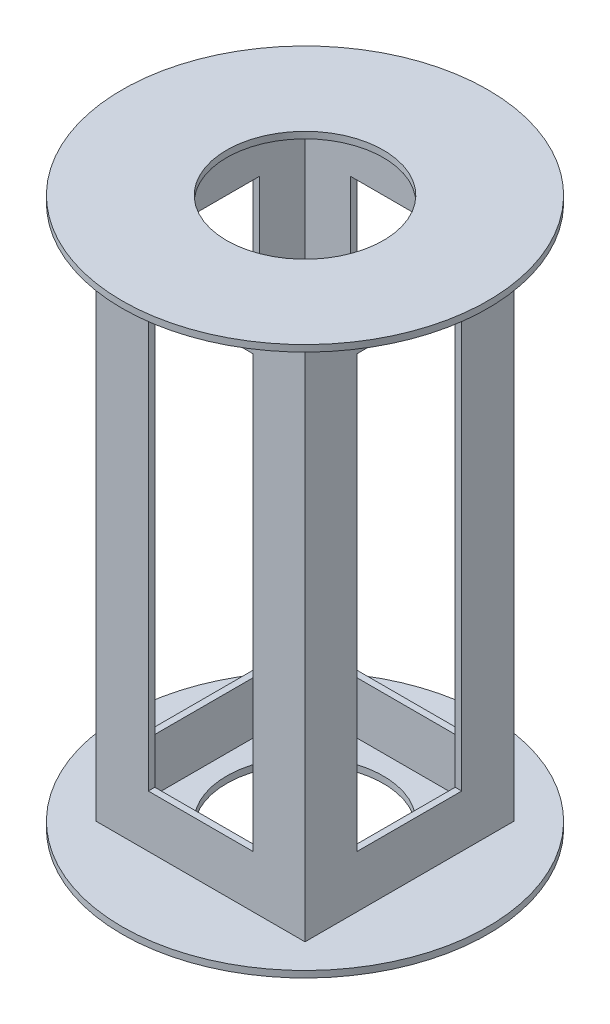
from build123d import *

# Parameters (mm, degrees)
SKETCH2_R               = 88.9
SKETCH2_R_2             = 38.1
BOSS_EXTRUDE1_DEPTH     = 3.175
SKETCH2_4_W             = 101.6
SKETCH2_4_H             = 101.6
SKETCH2_4_W_2           = 95.25
SKETCH2_4_H_2           = 95.25
BOSS_EXTRUDE2_DEPTH     = 266.7
BOSS_EXTRUDE3_START     = -3.175
SKETCH3_R               = 88.9
SKETCH3_R_2             = 38.1
BOSS_EXTRUDE3_DEPTH     = 3.175
CUT_EXTRUDE1_DEPTH      = 295.847943863
CUT_EXTRUDE1_DEPTH_BACK = 295.847943863
SKETCH4_W               = 50.8
SKETCH4_H               = 209.55
CUT_EXTRUDE2_DEPTH      = 295.847943863
CUT_EXTRUDE2_DEPTH_BACK = 295.847943863
SKETCH5_W               = 50.8
SKETCH5_H               = 209.55


with BuildPart() as part:
    # Sketch2 → Boss-Extrude1 (new body)
    with BuildSketch(Plane(origin=(0, 0, 0), x_dir=(1, 0, 0), z_dir=(0, 1, 0))):
        Circle(SKETCH2_R)
        Circle(SKETCH2_R_2, mode=Mode.SUBTRACT)
    extrude(amount=BOSS_EXTRUDE1_DEPTH)

    # Sketch2<4> → Boss-Extrude2 (add)
    with BuildSketch(Plane(origin=(0, 0, 0), x_dir=(1, 0, 0), z_dir=(0, 1, 0))):
        Rectangle(SKETCH2_4_W, SKETCH2_4_H)
        Rectangle(SKETCH2_4_W_2, SKETCH2_4_H_2, mode=Mode.SUBTRACT)
    extrude(amount=BOSS_EXTRUDE2_DEPTH)

    # Sketch3 → Boss-Extrude3 (add)
    with BuildSketch(Plane(origin=(0, 266.7, 0), x_dir=(1, 0, 0), z_dir=(0, 1, 0)).offset(BOSS_EXTRUDE3_START)):
        Circle(SKETCH3_R)
        Circle(SKETCH3_R_2, mode=Mode.SUBTRACT)
    extrude(amount=BOSS_EXTRUDE3_DEPTH)

    # Sketch4 → Cut-Extrude1 (cut, two sides: drawn at the far end of the back side and taken through both)
    with BuildSketch(Plane.XY.offset(-CUT_EXTRUDE1_DEPTH_BACK)):
        with Locations((0, 133.35)):
            Rectangle(SKETCH4_W, SKETCH4_H)
    extrude(amount=CUT_EXTRUDE1_DEPTH + CUT_EXTRUDE1_DEPTH_BACK, mode=Mode.SUBTRACT)

    # Sketch5 → Cut-Extrude2 (cut, two sides: drawn at the far end of the back side and taken through both)
    with BuildSketch(Plane(origin=(0, 0, 0), x_dir=(0, 0, -1), z_dir=(1, 0, 0)).offset(-CUT_EXTRUDE2_DEPTH_BACK)):
        with Locations((0, 133.35)):
            Rectangle(SKETCH5_W, SKETCH5_H)
    extrude(amount=CUT_EXTRUDE2_DEPTH + CUT_EXTRUDE2_DEPTH_BACK, mode=Mode.SUBTRACT)


solid = part.part
